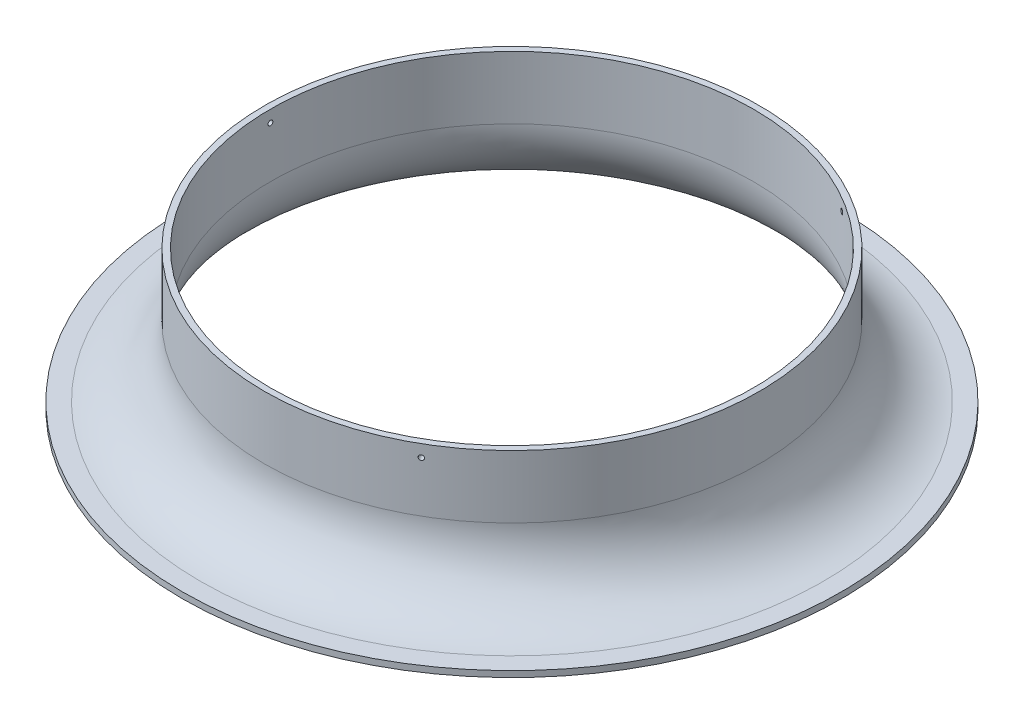
from build123d import *

# Parameters (mm, degrees)
LOFT_THIN1_START       = 39
LOFT_THIN1_OUTLINE_R   = 205
LOFT_THIN1_OUTLINE_R_2 = 200
LOFT_THIN1_DEPTH       = 52
SKETCH6_R              = 2
CUT_EXTRUDE1_DEPTH     = 10
CIRPATTERN1_COUNT      = 3


# Read off the part's stored shape, not the designer's step: Loft-Thin1
with BuildPart() as part:
    # Loft-Thin1 outline → Loft-Thin1 (new body)
    with BuildSketch(Plane(origin=(0, 0, 0), x_dir=(1, 0, 0), z_dir=(0, 1, 0)).offset(LOFT_THIN1_START)):
        Circle(LOFT_THIN1_OUTLINE_R)
        Circle(LOFT_THIN1_OUTLINE_R_2, mode=Mode.SUBTRACT)
    extrude(amount=LOFT_THIN1_DEPTH)

    # Sketch5 → Revolve-Thin2 (revolve)
    with BuildSketch(Plane.XY, mode=Mode.PRIVATE) as revolve_thin2_sk:
        with BuildLine():
            ThreePointArc((205, 39), (220.240453532, -0.187002767), (257.952454685, -18.779947095))
            Line((257.952454685, -18.779947095), (272.952454685, -18.779947095))
            Line((272.952454685, -18.779947095), (272.952454685, -23.779947095))
            Line((272.952454685, -23.779947095), (257.738988428, -23.779947095))
            ThreePointArc((257.738988428, -23.779947095), (216.629515158, -3.647135138), (200, 39))
            Line((200, 39), (205, 39))
        make_face()
    revolve(revolve_thin2_sk.sketch.rotate(Axis((0, 91, 0), (0, -1, 0)), 90), axis=Axis((0, 91, 0), (0, -1, 0)))

    # Sketch6 → Cut-Extrude1 (cut)
    with BuildSketch(Plane.ZY.offset(205)):
        with Locations((0, 81)):
            Circle(SKETCH6_R)
    cut_extrude1 = extrude(amount=-CUT_EXTRUDE1_DEPTH, mode=Mode.SUBTRACT)

    # CirPattern1: Cut-Extrude1 ×3 about axis
    cirpattern1_axis = Axis((0, 91, 0), (0, 1, 0))
    for i in range(1, CIRPATTERN1_COUNT):
        add(cut_extrude1.rotate(cirpattern1_axis, i * 360 / CIRPATTERN1_COUNT), mode=Mode.SUBTRACT)


solid = part.part
